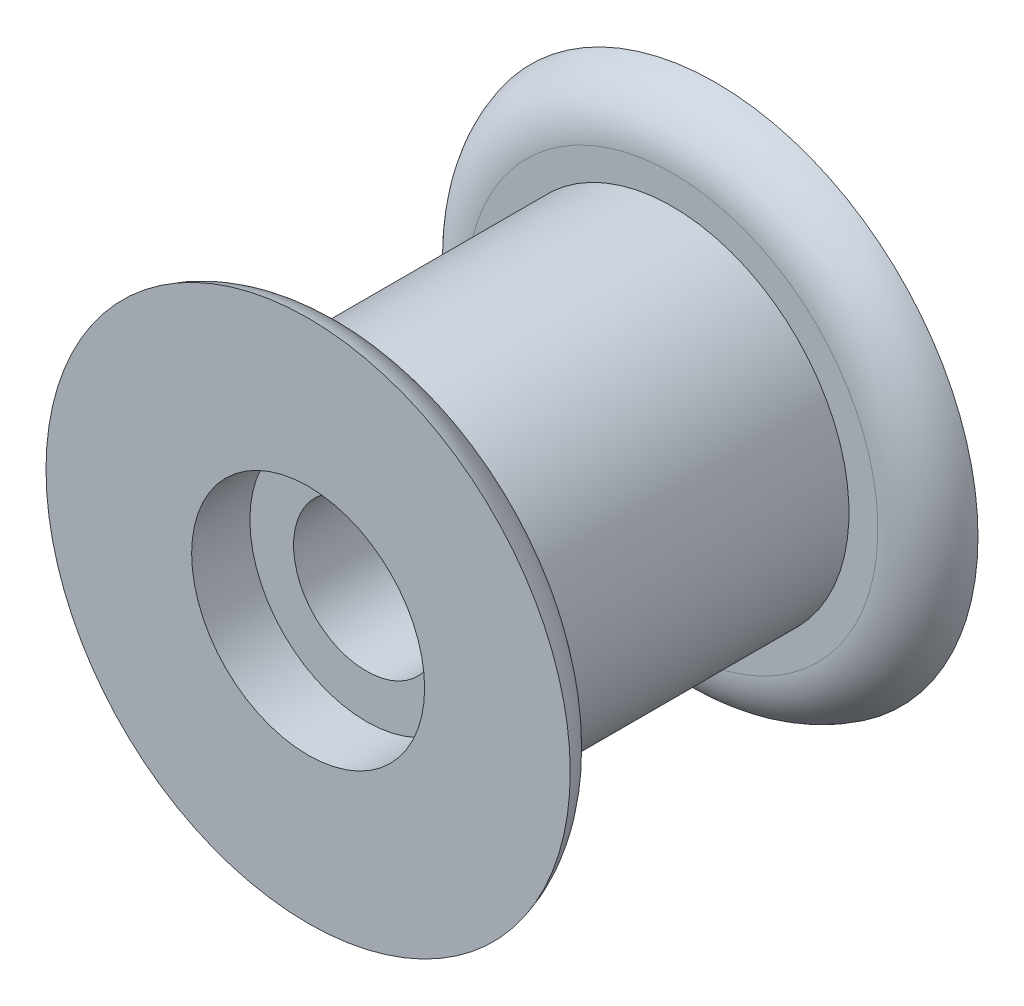
from build123d import *

# Parameters (mm, degrees)
FILLET1_R          = 2
SKETCH2_R          = 4
CUT_EXTRUDE2_DEPTH = 2
SKETCH4_R          = 2.5
CUT_EXTRUDE3_DEPTH = 10


with BuildPart() as part:
    # Sketch1 → Revolve1 (revolve)
    with BuildSketch(Plane(origin=(0, 0, 0), x_dir=(1, 0, 0), z_dir=(0, 1, 0)), mode=Mode.PRIVATE) as revolve1_sk:
        Polygon((0, 0), (9, 0), (9, -1.5), (6.07, -1.5), (6.07, -12.5), (9, -12.5), (9, -14), (0, -14), align=None)
    revolve(revolve1_sk.sketch.rotate(Axis((0, 0, -9.941176471), (0, 0, 1)), 180), axis=Axis((0, 0, -9.941176471), (0, 0, 1)))

    # Fillet1
    # the kernel refuses this fillet: 2 mm, written as the material it takes off along each edge
    with BuildSketch(Plane(origin=(0, 0, 12.5), x_dir=(-1, 0, 0), z_dir=(0, 1, 0))) as fillet1_piece_1:
        with BuildLine():
            CenterArc((7.063508327, 2), FILLET1_R, 270, 75.522487814)
            Line((9, 1.5), (9.038729833, 1.49))
            ThreePointArc((9.038729833, 1.49), (9.04, 0.75), (9.04, 0))
            Line((9.04, 0), (9, -0.04))
            Line((9, -0.04), (7.063508327, -0.04))
            Line((7.063508327, -0.04), (7.063508327, 0))
        make_face()
    revolve(axis=Axis((0, 0, 12.5), (0, 0, 1)), mode=Mode.SUBTRACT)
    with BuildSketch(Plane(origin=(0, 0, 1.5), x_dir=(-1, 0, 0), z_dir=(0, 1, 0))) as fillet1_piece_2:
        with BuildLine():
            CenterArc((7.063508327, -2), FILLET1_R, 14.477512186, 75.522487814)
            Line((7.063508327, 0), (7.063508327, 0.04))
            Line((7.063508327, 0.04), (9, 0.04))
            Line((9, 0.04), (9.04, 0))
            ThreePointArc((9.04, 0), (9.04, -0.75), (9.038729833, -1.49))
            Line((9.038729833, -1.49), (9, -1.5))
        make_face()
    revolve(axis=Axis((0, 0, 1.5), (0, 0, 1)), mode=Mode.SUBTRACT)

    # Sketch2 → Cut-Extrude2 (cut)
    with BuildSketch(Plane(origin=(0, 0, 0), x_dir=(-1, 0, 0), z_dir=(0, 0, -1))):
        Circle(SKETCH2_R)
    cut_extrude2 = extrude(amount=-CUT_EXTRUDE2_DEPTH, mode=Mode.SUBTRACT)

    # Mirror1: Cut-Extrude2 across plane
    add(cut_extrude2.mirror(Plane(origin=(0, 0, 7), x_dir=(1, 0, 0), z_dir=(0, 0, -1))), mode=Mode.SUBTRACT)

    # Sketch4 → Cut-Extrude3 (cut)
    with BuildSketch(Plane.XY.offset(12)):
        Circle(SKETCH4_R)
    extrude(amount=-CUT_EXTRUDE3_DEPTH, mode=Mode.SUBTRACT)


solid = part.part
